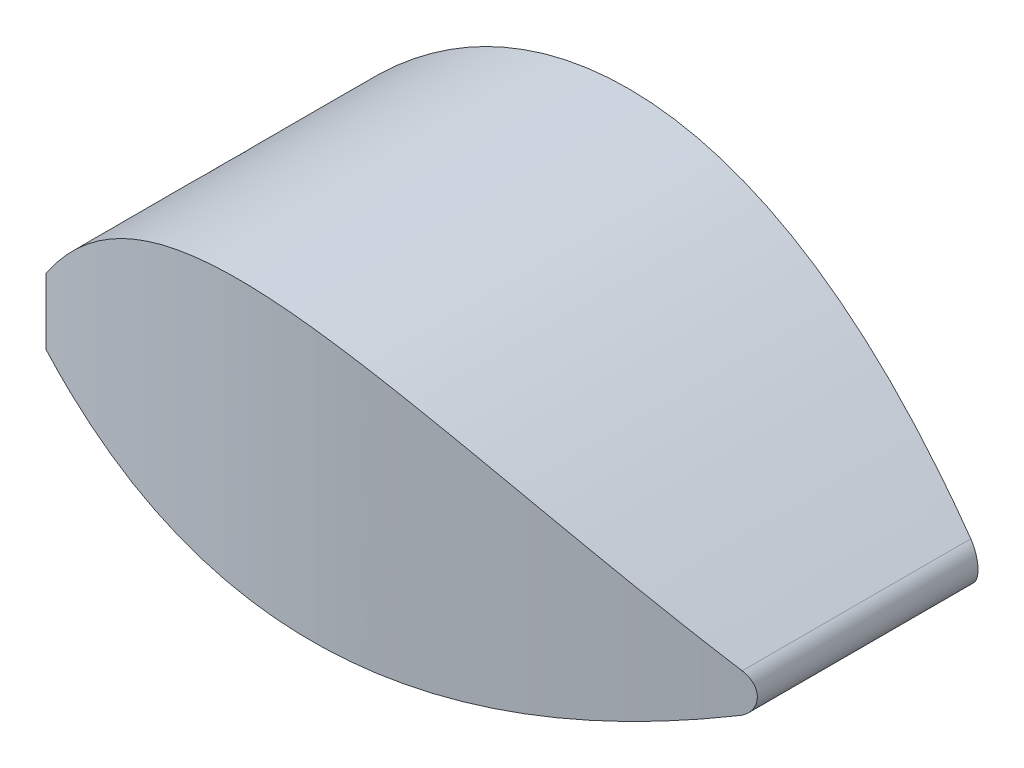
from build123d import *

# Parameters (mm, degrees)
BOSS_EXTRUDE1_DEPTH = 100
SKETCH2_W           = 32.4
SKETCH2_H           = 5.6
CUT_EXTRUDE1_DEPTH  = 20
FILLET2_R           = 5
CUT_EXTRUDE2_START  = -24
CUT_EXTRUDE2_DEPTH  = 64


with BuildPart() as part:
    # Sketch1 → Boss-Extrude1 (new body)
    with BuildSketch(Plane.XY):
        with BuildLine():
            Line((0, 5), (0, 10))
            add(Edge.make_bspline(
                [(0, 10), (44.096776055, 69.093814751), (116.180495262, 24.691377763), (160, 0)],
                knots=[0, 0, 0, 0, 1, 1, 1, 1], degree=3))
            add(Edge.make_bspline(
                [(0, -5), (72.416253581, -43.699775916), (160, 0)],
                knots=[0, 0, 0, 1, 1, 1], degree=2))
            Line((0, -5), (0, 0))
            Line((0, 0), (0, 5))
        make_face()
    extrude(amount=BOSS_EXTRUDE1_DEPTH)

    # Sketch2 → Cut-Extrude1 (cut)
    with BuildSketch(Plane.ZY):
        with Locations((50, 6.8)):
            Rectangle(SKETCH2_W, SKETCH2_H)
    extrude(amount=-CUT_EXTRUDE1_DEPTH, mode=Mode.SUBTRACT)

    # Fillet2
    fillet2_edges = [part.edges().sort_by_distance(p)[0] for p in [
        (160, 0, 50),
    ]]
    fillet(fillet2_edges, radius=FILLET2_R)

    # Cut-Extrude2: read off the stored shape, not the designer's step
    # Cut-Extrude2 outline → Cut-Extrude2 (cut)
    with BuildSketch(Plane(origin=(0, 0, 0), x_dir=(1, 0, 0), z_dir=(0, 1, 0)).offset(CUT_EXTRUDE2_START)):
        with BuildLine():
            add(Edge.make_bspline(
                [(0, -82), (76.537787844, -102.993151092), (154.18522925, -75)],
                knots=[0, 0, 0, 1, 1, 1], degree=2))
            Line((0, -82), (0, -100))
            Line((0, -100), (154.18522925, -100))
            Line((154.18522925, -100), (154.18522925, -75))
        make_face()
        with BuildLine():
            Line((154.185229284, 0), (0, 0))
            Line((0, 0), (0, -18))
            add(Edge.make_bspline(
                [(0, -18), (76.537787844, 2.993151092), (154.18522925, -25)],
                knots=[0, 0, 0, 1, 1, 1], degree=2))
            Line((154.18522925, -25), (154.185229284, 0))
        make_face()
    extrude(amount=CUT_EXTRUDE2_DEPTH, mode=Mode.SUBTRACT)


solid = part.part
